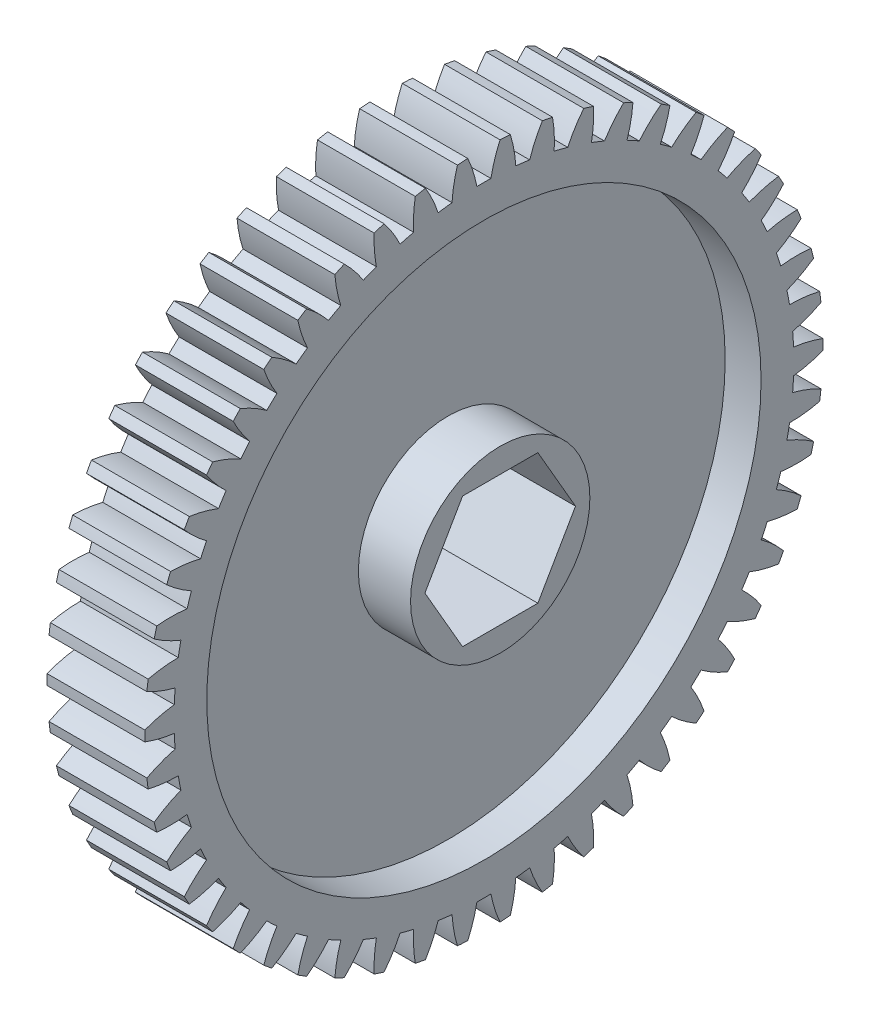
from build123d import *

# Parameters (mm, degrees)
SKETCH1_W           = 9.525
SKETCH1_H           = 33.02
CUT_EXTRUDE1_DEPTH  = 48.658854634
CUT_EXTRUDE2_DEPTH  = 48.658854634
CUT_EXTRUDE3_DEPTH  = 48.658854634
CUT_EXTRUDE4_DEPTH  = 48.658854634
CUT_EXTRUDE5_DEPTH  = 48.658854634
CUT_EXTRUDE6_DEPTH  = 48.658854634
CUT_EXTRUDE7_DEPTH  = 48.658854634
CUT_EXTRUDE8_DEPTH  = 48.658854634
CUT_EXTRUDE9_DEPTH  = 48.658854634
CUT_EXTRUDE10_DEPTH = 48.658854634
CUT_EXTRUDE11_DEPTH = 48.658854634
CUT_EXTRUDE12_DEPTH = 48.658854634
CUT_EXTRUDE13_DEPTH = 48.658854634
CUT_EXTRUDE14_DEPTH = 48.658854634
CUT_EXTRUDE15_DEPTH = 48.658854634
CUT_EXTRUDE16_DEPTH = 48.658854634
CUT_EXTRUDE17_DEPTH = 48.658854634
CUT_EXTRUDE18_DEPTH = 48.658854634
CUT_EXTRUDE19_DEPTH = 48.658854634
CUT_EXTRUDE20_DEPTH = 48.658854634
CUT_EXTRUDE21_DEPTH = 48.658854634
CUT_EXTRUDE22_DEPTH = 48.658854634
CUT_EXTRUDE23_DEPTH = 48.658854634
CUT_EXTRUDE24_DEPTH = 48.658854634
CUT_EXTRUDE25_DEPTH = 48.658854634
CUT_EXTRUDE26_DEPTH = 48.658854634
CUT_EXTRUDE27_DEPTH = 48.658854634
CUT_EXTRUDE28_DEPTH = 48.632979039
CUT_EXTRUDE29_DEPTH = 48.632979039
CUT_EXTRUDE30_DEPTH = 48.632979039
CUT_EXTRUDE31_DEPTH = 48.632979039
CUT_EXTRUDE32_DEPTH = 48.632979039
CUT_EXTRUDE33_DEPTH = 48.632979039
CUT_EXTRUDE34_DEPTH = 48.632979039
CUT_EXTRUDE35_DEPTH = 48.632979039
CUT_EXTRUDE36_DEPTH = 48.632979039
CUT_EXTRUDE37_DEPTH = 48.632979039
CUT_EXTRUDE38_DEPTH = 48.632979039
CUT_EXTRUDE39_DEPTH = 48.632979039
CUT_EXTRUDE40_DEPTH = 48.632979039
CUT_EXTRUDE41_DEPTH = 48.632979039
CUT_EXTRUDE42_DEPTH = 48.632979039
CUT_EXTRUDE43_DEPTH = 48.632979039
CUT_EXTRUDE44_DEPTH = 48.632979039
CUT_EXTRUDE45_DEPTH = 48.632979039
CUT_EXTRUDE46_DEPTH = 48.632979039
CUT_EXTRUDE47_DEPTH = 48.632979039
CUT_EXTRUDE48_DEPTH = 48.632979039
CUT_EXTRUDE49_DEPTH = 48.632979039
CUT_EXTRUDE50_DEPTH = 48.632979039
HOLE1_D             = 53.975
HOLE1_DEPTH         = 3.4925
SKETCH54_R          = 8.73125
BOSS_EXTRUDE1_DEPTH = 5.08
HOLE2_D             = 53.975
HOLE2_DEPTH         = 3.4925
BOSS_EXTRUDE2_START = 5.08
SKETCH57_R          = 8.73125
BOSS_EXTRUDE2_DEPTH = 5.08
CUT_EXTRUDE51_DEPTH = 49.368016986


with BuildPart() as part:
    # Sketch1 → Revolve1 (revolve)
    with BuildSketch(Plane(origin=(0, 0, 0), x_dir=(-1, 0, 0), z_dir=(0, 0, -1))):
        with Locations((-4.7625, 16.51)):
            Rectangle(SKETCH1_W, SKETCH1_H)
    revolve(axis=Axis((9.525, 0, 0), (-1, 0, 0)))

    # Sketch2 → Cut-Extrude1 (cut, through all)
    with BuildSketch(Plane.ZY):
        with BuildLine():
            ThreePointArc((-2.575937954, 32.919370341), (-4.138503372, 32.759627437), (-5.691704369, 32.525757507))
            ThreePointArc((-5.691704369, 32.525757507), (-4.996674373, 31.220882798), (-4.457999437, 29.844077068))
            ThreePointArc((-4.457999437, 29.844077068), (-3.781955389, 29.937259535), (-3.103976971, 30.015129885))
            ThreePointArc((-3.103976971, 30.015129885), (-2.924623161, 31.482643739), (-2.575937954, 32.919370341))
        make_face()
    extrude(amount=-CUT_EXTRUDE1_DEPTH, mode=Mode.SUBTRACT)

    # Sketch3 → Cut-Extrude2 (cut, through all)
    with BuildSketch(Plane.ZY):
        with BuildLine():
            ThreePointArc((1.570265218, 32.982641907), (0, 33.02), (-1.570265218, 32.982641907))
            ThreePointArc((-1.570265218, 32.982641907), (-1.044259907, 31.600946168), (-0.682392098, 30.167483091))
            ThreePointArc((-0.682392098, 30.167483091), (0, 30.1752), (0.682392098, 30.167483091))
            ThreePointArc((0.682392098, 30.167483091), (1.044259907, 31.600946168), (1.570265218, 32.982641907))
        make_face()
    extrude(amount=-CUT_EXTRUDE2_DEPTH, mode=Mode.SUBTRACT)

    # Sketch4 → Cut-Extrude3 (cut, through all)
    with BuildSketch(Plane.ZY):
        with BuildLine():
            ThreePointArc((5.691704369, 32.525757507), (4.138503372, 32.759627437), (2.575937954, 32.919370341))
            ThreePointArc((2.575937954, 32.919370341), (2.924623161, 31.482643739), (3.103976971, 30.015129885))
            ThreePointArc((3.103976971, 30.015129885), (3.781955389, 29.937259535), (4.457999437, 29.844077068))
            ThreePointArc((4.457999437, 29.844077068), (4.996674373, 31.220882798), (5.691704369, 32.525757507))
        make_face()
    extrude(amount=-CUT_EXTRUDE3_DEPTH, mode=Mode.SUBTRACT)

    # Sketch5 → Cut-Extrude4 (cut, through all)
    with BuildSketch(Plane.ZY):
        with BuildLine():
            ThreePointArc((9.723381942, 31.555922481), (8.211740074, 31.98261598), (6.681517046, 32.33694064))
            ThreePointArc((6.681517046, 32.33694064), (6.847383175, 30.867841212), (6.84139447, 29.38942015))
            ThreePointArc((6.84139447, 29.38942015), (7.504267083, 29.227190604), (8.163301462, 29.050012122))
            ThreePointArc((8.163301462, 29.050012122), (8.870288299, 30.348447455), (9.723381942, 31.555922481))
        make_face()
    extrude(amount=-CUT_EXTRUDE4_DEPTH, mode=Mode.SUBTRACT)

    # Sketch6 → Cut-Extrude5 (cut, through all)
    with BuildSketch(Plane.ZY):
        with BuildLine():
            ThreePointArc((13.601715974, 30.088431707), (12.15547273, 30.701219564), (10.681724622, 31.244538068))
            ThreePointArc((10.681724622, 31.244538068), (10.662155866, 29.76623439), (10.470919091, 28.300221703))
            ThreePointArc((10.470919091, 28.300221703), (11.108232002, 28.056191417), (11.739863346, 27.797811131))
            ThreePointArc((11.739863346, 27.797811131), (12.604012479, 28.997398967), (13.601715974, 30.088431707))
        make_face()
    extrude(amount=-CUT_EXTRUDE5_DEPTH, mode=Mode.SUBTRACT)

    # Sketch7 → Cut-Extrude6 (cut, through all)
    with BuildSketch(Plane.ZY):
        with BuildLine():
            ThreePointArc((17.26554282, 28.14642839), (15.907506319, 28.935646575), (14.513475021, 29.659390466))
            ThreePointArc((14.513475021, 29.659390466), (14.308779989, 28.195196269), (13.935311063, 26.764711854))
            ThreePointArc((13.935311063, 26.764711854), (14.537013467, 26.442729332), (15.131280572, 26.107222052))
            ThreePointArc((15.131280572, 26.107222052), (16.138963854, 27.189044175), (17.26554282, 28.14642839))
        make_face()
    extrude(amount=-CUT_EXTRUDE6_DEPTH, mode=Mode.SUBTRACT)

    # Sketch8 → Cut-Extrude7 (cut, through all)
    with BuildSketch(Plane.ZY):
        with BuildLine():
            ThreePointArc((20.657081741, 25.760539085), (19.408669031, 26.713741154), (18.116339248, 27.606496559))
            ThreePointArc((18.116339248, 27.606496559), (17.729746104, 26.179503061), (17.179934855, 24.80710651))
            ThreePointArc((17.179934855, 24.80710651), (17.736537545, 24.412249609), (18.284068464, 24.004906487))
            ThreePointArc((18.284068464, 24.004906487), (19.419394127, 24.951901915), (20.657081741, 25.760539085))
        make_face()
    extrude(amount=-CUT_EXTRUDE7_DEPTH, mode=Mode.SUBTRACT)

    # Sketch9 → Cut-Extrude8 (cut, through all)
    with BuildSketch(Plane.ZY):
        with BuildLine():
            ThreePointArc((23.722846143, 22.968390689), (22.603745438, 24.070544077), (21.433497983, 25.11823171))
            ThreePointArc((21.433497983, 25.11823171), (20.871103533, 23.75094345), (20.153620812, 22.458278278))
            ThreePointArc((20.153620812, 22.458278278), (20.656345831, 21.996774126), (21.148505675, 21.524019206))
            ThreePointArc((21.148505675, 21.524019206), (22.393568955, 22.321253256), (23.722846143, 22.968390689))
        make_face()
    extrude(amount=-CUT_EXTRUDE8_DEPTH, mode=Mode.SUBTRACT)

    # Sketch10 → Cut-Extrude9 (cut, through all)
    with BuildSketch(Plane.ZY):
        with BuildLine():
            ThreePointArc((26.414487091, 19.814017052), (25.442347276, 21.047740142), (24.412637651, 22.233837341))
            ThreePointArc((24.412637651, 22.233837341), (23.68331119, 20.947817273), (22.809472129, 19.755269581))
            ThreePointArc((22.809472129, 19.755269581), (23.250391203, 19.234396375), (23.679418317, 18.703685284))
            ThreePointArc((23.679418317, 18.703685284), (25.014583823, 19.338585099), (26.414487091, 19.814017052))
        make_face()
    extrude(amount=-CUT_EXTRUDE9_DEPTH, mode=Mode.SUBTRACT)

    # Sketch11 → Cut-Extrude10 (cut, through all)
    with BuildSketch(Plane.ZY):
        with BuildLine():
            ThreePointArc((28.689555797, 16.347164529), (27.8797081, 17.69300077), (27.00677544, 18.998802076))
            ThreePointArc((27.00677544, 18.998802076), (26.122018882, 17.814331504), (25.105604445, 16.740708482))
            ThreePointArc((25.105604445, 16.740708482), (25.477764018, 16.168680704), (25.836892387, 15.588383073))
            ThreePointArc((25.836892387, 15.588383073), (27.241103761, 16.050935902), (28.689555797, 16.347164529))
        make_face()
    extrude(amount=-CUT_EXTRUDE10_DEPTH, mode=Mode.SUBTRACT)

    # Sketch12 → Cut-Extrude11 (cut, through all)
    with BuildSketch(Plane.ZY):
        with BuildLine():
            ThreePointArc((30.512173071, 12.622507457), (29.877389272, 14.059232207), (29.175000247, 15.464144353))
            ThreePointArc((29.175000247, 15.464144353), (28.148766733, 14.399903086), (27.005806382, 13.46213641))
            ThreePointArc((27.005806382, 13.46213641), (27.303337274, 12.847975279), (27.58690323, 12.227242748))
            ThreePointArc((27.58690323, 12.227242748), (29.038015219, 12.510153858), (30.512173071, 12.622507457))
        make_face()
    extrude(amount=-CUT_EXTRUDE11_DEPTH, mode=Mode.SUBTRACT)

    # Sketch13 → Cut-Extrude12 (cut, through all)
    with BuildSketch(Plane.ZY):
        with BuildLine():
            ThreePointArc((31.853595148, 8.698785901), (31.403886168, 10.203741154), (30.883117872, 11.685607836))
            ThreePointArc((30.883117872, 11.685607836), (29.731591716, 10.758379593), (28.480110619, 9.971258405))
            ThreePointArc((28.480110619, 9.971258405), (28.698320591, 9.324649609), (28.901852129, 8.673271501))
            ThreePointArc((28.901852129, 8.673271501), (30.376979832, 8.772079215), (31.853595148, 8.698785901))
        make_face()
    extrude(amount=-CUT_EXTRUDE12_DEPTH, mode=Mode.SUBTRACT)

    # Sketch14 → Cut-Extrude13 (cut, through all)
    with BuildSketch(Plane.ZY):
        with BuildLine():
            ThreePointArc((32.692667001, 4.637879295), (32.435125019, 6.187331008), (32.10419028, 7.722782302))
            ThreePointArc((32.10419028, 7.722782302), (30.845531737, 6.947190028), (29.505266499, 6.323127698))
            ThreePointArc((29.505266499, 6.323127698), (29.640714248, 5.654268644), (29.761001556, 4.982517581))
            ThreePointArc((29.761001556, 4.982517581), (31.236881326, 4.895663642), (32.692667001, 4.637879295))
        make_face()
    extrude(amount=-CUT_EXTRUDE13_DEPTH, mode=Mode.SUBTRACT)

    # Sketch15 → Cut-Extrude14 (cut, through all)
    with BuildSketch(Plane.ZY):
        with BuildLine():
            ThreePointArc((33.016155966, 0.503830563), (32.954842573, 2.073342955), (32.818960428, 3.638163879))
            ThreePointArc((32.818960428, 3.638163879), (31.473019297, 3.026439126), (30.0651067, 2.57527749))
            ThreePointArc((30.0651067, 2.57527749), (30.115656136, 1.894716485), (30.150802209, 1.213186383))
            ThreePointArc((30.150802209, 1.213186383), (31.604158541, 0.942040529), (33.016155966, 0.503830563))
        make_face()
    extrude(amount=-CUT_EXTRUDE14_DEPTH, mode=Mode.SUBTRACT)

    # Sketch16 → Cut-Extrude15 (cut, through all)
    with BuildSketch(Plane.ZY):
        with BuildLine():
            ThreePointArc((32.818960428, -3.638163879), (32.954842573, -2.073342955), (33.016155966, -0.503830563))
            ThreePointArc((33.016155966, -0.503830563), (31.604158541, -0.942040529), (30.150802209, -1.213186383))
            ThreePointArc((30.150802209, -1.213186383), (30.115656136, -1.894716485), (30.0651067, -2.57527749))
            ThreePointArc((30.0651067, -2.57527749), (31.473019297, -3.026439126), (32.818960428, -3.638163879))
        make_face()
    extrude(amount=-CUT_EXTRUDE15_DEPTH, mode=Mode.SUBTRACT)

    # Sketch17 → Cut-Extrude16 (cut, through all)
    with BuildSketch(Plane.ZY):
        with BuildLine():
            ThreePointArc((32.10419028, -7.722782302), (32.435125019, -6.187331008), (32.692667001, -4.637879295))
            ThreePointArc((32.692667001, -4.637879295), (31.236881326, -4.895663642), (29.761001556, -4.982517581))
            ThreePointArc((29.761001556, -4.982517581), (29.640714248, -5.654268644), (29.505266499, -6.323127698))
            ThreePointArc((29.505266499, -6.323127698), (30.845531737, -6.947190028), (32.10419028, -7.722782302))
        make_face()
    extrude(amount=-CUT_EXTRUDE16_DEPTH, mode=Mode.SUBTRACT)

    # Sketch18 → Cut-Extrude17 (cut, through all)
    with BuildSketch(Plane.ZY):
        with BuildLine():
            ThreePointArc((30.883117872, -11.685607836), (31.403886168, -10.203741154), (31.853595148, -8.698785901))
            ThreePointArc((31.853595148, -8.698785901), (30.376979832, -8.772079215), (28.901852129, -8.673271501))
            ThreePointArc((28.901852129, -8.673271501), (28.698320591, -9.324649609), (28.480110619, -9.971258405))
            ThreePointArc((28.480110619, -9.971258405), (29.731591716, -10.758379593), (30.883117872, -11.685607836))
        make_face()
    extrude(amount=-CUT_EXTRUDE17_DEPTH, mode=Mode.SUBTRACT)

    # Sketch19 → Cut-Extrude18 (cut, through all)
    with BuildSketch(Plane.ZY):
        with BuildLine():
            ThreePointArc((29.175000247, -15.464144353), (29.877389272, -14.059232207), (30.512173071, -12.622507457))
            ThreePointArc((30.512173071, -12.622507457), (29.038015219, -12.510153858), (27.58690323, -12.227242748))
            ThreePointArc((27.58690323, -12.227242748), (27.303337274, -12.847975279), (27.005806382, -13.46213641))
            ThreePointArc((27.005806382, -13.46213641), (28.148766733, -14.399903086), (29.175000247, -15.464144353))
        make_face()
    extrude(amount=-CUT_EXTRUDE18_DEPTH, mode=Mode.SUBTRACT)

    # Sketch20 → Cut-Extrude19 (cut, through all)
    with BuildSketch(Plane.ZY):
        with BuildLine():
            ThreePointArc((27.00677544, -18.998802076), (27.8797081, -17.69300077), (28.689555797, -16.347164529))
            ThreePointArc((28.689555797, -16.347164529), (27.241103761, -16.050935902), (25.836892387, -15.588383073))
            ThreePointArc((25.836892387, -15.588383073), (25.477764018, -16.168680704), (25.105604445, -16.740708482))
            ThreePointArc((25.105604445, -16.740708482), (26.122018882, -17.814331504), (27.00677544, -18.998802076))
        make_face()
    extrude(amount=-CUT_EXTRUDE19_DEPTH, mode=Mode.SUBTRACT)

    # Sketch21 → Cut-Extrude20 (cut, through all)
    with BuildSketch(Plane.ZY):
        with BuildLine():
            ThreePointArc((24.412637651, -22.233837341), (25.442347276, -21.047740142), (26.414487091, -19.814017052))
            ThreePointArc((26.414487091, -19.814017052), (25.014583823, -19.338585099), (23.679418317, -18.703685284))
            ThreePointArc((23.679418317, -18.703685284), (23.250391203, -19.234396375), (22.809472129, -19.755269581))
            ThreePointArc((22.809472129, -19.755269581), (23.68331119, -20.947817273), (24.412637651, -22.233837341))
        make_face()
    extrude(amount=-CUT_EXTRUDE20_DEPTH, mode=Mode.SUBTRACT)

    # Sketch22 → Cut-Extrude21 (cut, through all)
    with BuildSketch(Plane.ZY):
        with BuildLine():
            ThreePointArc((21.433497983, -25.11823171), (22.603745438, -24.070544077), (23.722846143, -22.968390689))
            ThreePointArc((23.722846143, -22.968390689), (22.393568955, -22.321253256), (21.148505675, -21.524019206))
            ThreePointArc((21.148505675, -21.524019206), (20.656345831, -21.996774126), (20.153620812, -22.458278278))
            ThreePointArc((20.153620812, -22.458278278), (20.871103533, -23.75094345), (21.433497983, -25.11823171))
        make_face()
    extrude(amount=-CUT_EXTRUDE21_DEPTH, mode=Mode.SUBTRACT)

    # Sketch23 → Cut-Extrude22 (cut, through all)
    with BuildSketch(Plane.ZY):
        with BuildLine():
            ThreePointArc((18.116339248, -27.606496559), (19.408669031, -26.713741154), (20.657081741, -25.760539085))
            ThreePointArc((20.657081741, -25.760539085), (19.419394127, -24.951901915), (18.284068464, -24.004906487))
            ThreePointArc((18.284068464, -24.004906487), (17.736537545, -24.412249609), (17.179934855, -24.80710651))
            ThreePointArc((17.179934855, -24.80710651), (17.729746104, -26.179503061), (18.116339248, -27.606496559))
        make_face()
    extrude(amount=-CUT_EXTRUDE22_DEPTH, mode=Mode.SUBTRACT)

    # Sketch24 → Cut-Extrude23 (cut, through all)
    with BuildSketch(Plane.ZY):
        with BuildLine():
            ThreePointArc((14.513475021, -29.659390466), (15.907506319, -28.935646575), (17.26554282, -28.14642839))
            ThreePointArc((17.26554282, -28.14642839), (16.138963854, -27.189044175), (15.131280572, -26.107222052))
            ThreePointArc((15.131280572, -26.107222052), (14.537013467, -26.442729332), (13.935311063, -26.764711854))
            ThreePointArc((13.935311063, -26.764711854), (14.308779989, -28.195196269), (14.513475021, -29.659390466))
        make_face()
    extrude(amount=-CUT_EXTRUDE23_DEPTH, mode=Mode.SUBTRACT)

    # Sketch25 → Cut-Extrude24 (cut, through all)
    with BuildSketch(Plane.ZY):
        with BuildLine():
            ThreePointArc((10.681724622, -31.244538068), (12.15547273, -30.701219564), (13.601715974, -30.088431707))
            ThreePointArc((13.601715974, -30.088431707), (12.604012479, -28.997398967), (11.739863346, -27.797811131))
            ThreePointArc((11.739863346, -27.797811131), (11.108232002, -28.056191417), (10.470919091, -28.300221703))
            ThreePointArc((10.470919091, -28.300221703), (10.662155866, -29.76623439), (10.681724622, -31.244538068))
        make_face()
    extrude(amount=-CUT_EXTRUDE24_DEPTH, mode=Mode.SUBTRACT)

    # Sketch26 → Cut-Extrude25 (cut, through all)
    with BuildSketch(Plane.ZY):
        with BuildLine():
            ThreePointArc((6.681517046, -32.33694064), (8.211740074, -31.98261598), (9.723381942, -31.555922481))
            ThreePointArc((9.723381942, -31.555922481), (8.870288299, -30.348447455), (8.163301462, -29.050012122))
            ThreePointArc((8.163301462, -29.050012122), (7.504267083, -29.227190604), (6.84139447, -29.38942015))
            ThreePointArc((6.84139447, -29.38942015), (6.847383175, -30.867841212), (6.681517046, -32.33694064))
        make_face()
    extrude(amount=-CUT_EXTRUDE25_DEPTH, mode=Mode.SUBTRACT)

    # Sketch27 → Cut-Extrude26 (cut, through all)
    with BuildSketch(Plane.ZY):
        with BuildLine():
            ThreePointArc((2.575937954, -32.919370341), (4.138503372, -32.759627437), (5.691704369, -32.525757507))
            ThreePointArc((5.691704369, -32.525757507), (4.996674373, -31.220882798), (4.457999437, -29.844077068))
            ThreePointArc((4.457999437, -29.844077068), (3.781955389, -29.937259535), (3.103976971, -30.015129885))
            ThreePointArc((3.103976971, -30.015129885), (2.924623161, -31.482643739), (2.575937954, -32.919370341))
        make_face()
    extrude(amount=-CUT_EXTRUDE26_DEPTH, mode=Mode.SUBTRACT)

    # Sketch28 → Cut-Extrude27 (cut, through all)
    with BuildSketch(Plane.ZY):
        with BuildLine():
            ThreePointArc((-1.570265218, -32.982641907), (0, -33.02), (1.570265218, -32.982641907))
            ThreePointArc((1.570265218, -32.982641907), (1.044259907, -31.600946168), (0.682392098, -30.167483091))
            ThreePointArc((0.682392098, -30.167483091), (0, -30.1752), (-0.682392098, -30.167483091))
            ThreePointArc((-0.682392098, -30.167483091), (-1.044259907, -31.600946168), (-1.570265218, -32.982641907))
        make_face()
    extrude(amount=-CUT_EXTRUDE27_DEPTH, mode=Mode.SUBTRACT)

    # Sketch29 → Cut-Extrude28 (cut, through all)
    with BuildSketch(Plane.ZY):
        with BuildLine():
            ThreePointArc((-5.691704369, -32.525757507), (-4.138503372, -32.759627437), (-2.575937954, -32.919370341))
            ThreePointArc((-2.575937954, -32.919370341), (-2.924623161, -31.482643739), (-3.103976971, -30.015129885))
            ThreePointArc((-3.103976971, -30.015129885), (-3.781955389, -29.937259535), (-4.457999437, -29.844077068))
            ThreePointArc((-4.457999437, -29.844077068), (-4.996674373, -31.220882798), (-5.691704369, -32.525757507))
        make_face()
    extrude(amount=-CUT_EXTRUDE28_DEPTH, mode=Mode.SUBTRACT)

    # Sketch30 → Cut-Extrude29 (cut, through all)
    with BuildSketch(Plane.ZY):
        with BuildLine():
            ThreePointArc((-9.723381942, -31.555922481), (-8.211740074, -31.98261598), (-6.681517046, -32.33694064))
            ThreePointArc((-6.681517046, -32.33694064), (-6.847383175, -30.867841212), (-6.84139447, -29.38942015))
            ThreePointArc((-6.84139447, -29.38942015), (-7.504267083, -29.227190604), (-8.163301462, -29.050012122))
            ThreePointArc((-8.163301462, -29.050012122), (-8.870288299, -30.348447455), (-9.723381942, -31.555922481))
        make_face()
    extrude(amount=-CUT_EXTRUDE29_DEPTH, mode=Mode.SUBTRACT)

    # Sketch31 → Cut-Extrude30 (cut, through all)
    with BuildSketch(Plane.ZY):
        with BuildLine():
            ThreePointArc((-13.601715974, -30.088431707), (-12.15547273, -30.701219564), (-10.681724622, -31.244538068))
            ThreePointArc((-10.681724622, -31.244538068), (-10.662155866, -29.76623439), (-10.470919091, -28.300221703))
            ThreePointArc((-10.470919091, -28.300221703), (-11.108232002, -28.056191417), (-11.739863346, -27.797811131))
            ThreePointArc((-11.739863346, -27.797811131), (-12.604012479, -28.997398967), (-13.601715974, -30.088431707))
        make_face()
    extrude(amount=-CUT_EXTRUDE30_DEPTH, mode=Mode.SUBTRACT)

    # Sketch32 → Cut-Extrude31 (cut, through all)
    with BuildSketch(Plane.ZY):
        with BuildLine():
            ThreePointArc((-17.26554282, -28.14642839), (-15.907506319, -28.935646575), (-14.513475021, -29.659390466))
            ThreePointArc((-14.513475021, -29.659390466), (-14.308779989, -28.195196269), (-13.935311063, -26.764711854))
            ThreePointArc((-13.935311063, -26.764711854), (-14.537013467, -26.442729332), (-15.131280572, -26.107222052))
            ThreePointArc((-15.131280572, -26.107222052), (-16.138963854, -27.189044175), (-17.26554282, -28.14642839))
        make_face()
    extrude(amount=-CUT_EXTRUDE31_DEPTH, mode=Mode.SUBTRACT)

    # Sketch33 → Cut-Extrude32 (cut, through all)
    with BuildSketch(Plane.ZY):
        with BuildLine():
            ThreePointArc((-20.657081741, -25.760539085), (-19.408669031, -26.713741154), (-18.116339248, -27.606496559))
            ThreePointArc((-18.116339248, -27.606496559), (-17.729746104, -26.179503061), (-17.179934855, -24.80710651))
            ThreePointArc((-17.179934855, -24.80710651), (-17.736537545, -24.412249609), (-18.284068464, -24.004906487))
            ThreePointArc((-18.284068464, -24.004906487), (-19.419394127, -24.951901915), (-20.657081741, -25.760539085))
        make_face()
    extrude(amount=-CUT_EXTRUDE32_DEPTH, mode=Mode.SUBTRACT)

    # Sketch34 → Cut-Extrude33 (cut, through all)
    with BuildSketch(Plane.ZY):
        with BuildLine():
            ThreePointArc((-23.722846143, -22.968390689), (-22.603745438, -24.070544077), (-21.433497983, -25.11823171))
            ThreePointArc((-21.433497983, -25.11823171), (-20.871103533, -23.75094345), (-20.153620812, -22.458278278))
            ThreePointArc((-20.153620812, -22.458278278), (-20.656345831, -21.996774126), (-21.148505675, -21.524019206))
            ThreePointArc((-21.148505675, -21.524019206), (-22.393568955, -22.321253256), (-23.722846143, -22.968390689))
        make_face()
    extrude(amount=-CUT_EXTRUDE33_DEPTH, mode=Mode.SUBTRACT)

    # Sketch35 → Cut-Extrude34 (cut, through all)
    with BuildSketch(Plane.ZY):
        with BuildLine():
            ThreePointArc((-26.414487091, -19.814017052), (-25.442347276, -21.047740142), (-24.412637651, -22.233837341))
            ThreePointArc((-24.412637651, -22.233837341), (-23.68331119, -20.947817273), (-22.809472129, -19.755269581))
            ThreePointArc((-22.809472129, -19.755269581), (-23.250391203, -19.234396375), (-23.679418317, -18.703685284))
            ThreePointArc((-23.679418317, -18.703685284), (-25.014583823, -19.338585099), (-26.414487091, -19.814017052))
        make_face()
    extrude(amount=-CUT_EXTRUDE34_DEPTH, mode=Mode.SUBTRACT)

    # Sketch36 → Cut-Extrude35 (cut, through all)
    with BuildSketch(Plane.ZY):
        with BuildLine():
            ThreePointArc((-28.689555797, -16.347164529), (-27.8797081, -17.69300077), (-27.00677544, -18.998802076))
            ThreePointArc((-27.00677544, -18.998802076), (-26.122018882, -17.814331504), (-25.105604445, -16.740708482))
            ThreePointArc((-25.105604445, -16.740708482), (-25.477764018, -16.168680704), (-25.836892387, -15.588383073))
            ThreePointArc((-25.836892387, -15.588383073), (-27.241103761, -16.050935902), (-28.689555797, -16.347164529))
        make_face()
    extrude(amount=-CUT_EXTRUDE35_DEPTH, mode=Mode.SUBTRACT)

    # Sketch37 → Cut-Extrude36 (cut, through all)
    with BuildSketch(Plane.ZY):
        with BuildLine():
            ThreePointArc((-30.512173071, -12.622507457), (-29.877389272, -14.059232207), (-29.175000247, -15.464144353))
            ThreePointArc((-29.175000247, -15.464144353), (-28.148766733, -14.399903086), (-27.005806382, -13.46213641))
            ThreePointArc((-27.005806382, -13.46213641), (-27.303337274, -12.847975279), (-27.58690323, -12.227242748))
            ThreePointArc((-27.58690323, -12.227242748), (-29.038015219, -12.510153858), (-30.512173071, -12.622507457))
        make_face()
    extrude(amount=-CUT_EXTRUDE36_DEPTH, mode=Mode.SUBTRACT)

    # Sketch38 → Cut-Extrude37 (cut, through all)
    with BuildSketch(Plane.ZY):
        with BuildLine():
            ThreePointArc((-31.853595148, -8.698785901), (-31.403886168, -10.203741154), (-30.883117872, -11.685607836))
            ThreePointArc((-30.883117872, -11.685607836), (-29.731591716, -10.758379593), (-28.480110619, -9.971258405))
            ThreePointArc((-28.480110619, -9.971258405), (-28.698320591, -9.324649609), (-28.901852129, -8.673271501))
            ThreePointArc((-28.901852129, -8.673271501), (-30.376979832, -8.772079215), (-31.853595148, -8.698785901))
        make_face()
    extrude(amount=-CUT_EXTRUDE37_DEPTH, mode=Mode.SUBTRACT)

    # Sketch39 → Cut-Extrude38 (cut, through all)
    with BuildSketch(Plane.ZY):
        with BuildLine():
            ThreePointArc((-32.692667001, -4.637879295), (-32.435125019, -6.187331008), (-32.10419028, -7.722782302))
            ThreePointArc((-32.10419028, -7.722782302), (-30.845531737, -6.947190028), (-29.505266499, -6.323127698))
            ThreePointArc((-29.505266499, -6.323127698), (-29.640714248, -5.654268644), (-29.761001556, -4.982517581))
            ThreePointArc((-29.761001556, -4.982517581), (-31.236881326, -4.895663642), (-32.692667001, -4.637879295))
        make_face()
    extrude(amount=-CUT_EXTRUDE38_DEPTH, mode=Mode.SUBTRACT)

    # Sketch40 → Cut-Extrude39 (cut, through all)
    with BuildSketch(Plane.ZY):
        with BuildLine():
            ThreePointArc((-33.016155966, -0.503830563), (-32.954842573, -2.073342955), (-32.818960428, -3.638163879))
            ThreePointArc((-32.818960428, -3.638163879), (-31.473019297, -3.026439126), (-30.0651067, -2.57527749))
            ThreePointArc((-30.0651067, -2.57527749), (-30.115656136, -1.894716485), (-30.150802209, -1.213186383))
            ThreePointArc((-30.150802209, -1.213186383), (-31.604158541, -0.942040529), (-33.016155966, -0.503830563))
        make_face()
    extrude(amount=-CUT_EXTRUDE39_DEPTH, mode=Mode.SUBTRACT)

    # Sketch41 → Cut-Extrude40 (cut, through all)
    with BuildSketch(Plane.ZY):
        with BuildLine():
            ThreePointArc((-32.818960428, 3.638163879), (-32.954842573, 2.073342955), (-33.016155966, 0.503830563))
            ThreePointArc((-33.016155966, 0.503830563), (-31.604158541, 0.942040529), (-30.150802209, 1.213186383))
            ThreePointArc((-30.150802209, 1.213186383), (-30.115656136, 1.894716485), (-30.0651067, 2.57527749))
            ThreePointArc((-30.0651067, 2.57527749), (-31.473019297, 3.026439126), (-32.818960428, 3.638163879))
        make_face()
    extrude(amount=-CUT_EXTRUDE40_DEPTH, mode=Mode.SUBTRACT)

    # Sketch42 → Cut-Extrude41 (cut, through all)
    with BuildSketch(Plane.ZY):
        with BuildLine():
            ThreePointArc((-32.10419028, 7.722782302), (-32.435125019, 6.187331008), (-32.692667001, 4.637879295))
            ThreePointArc((-32.692667001, 4.637879295), (-31.236881326, 4.895663642), (-29.761001556, 4.982517581))
            ThreePointArc((-29.761001556, 4.982517581), (-29.640714248, 5.654268644), (-29.505266499, 6.323127698))
            ThreePointArc((-29.505266499, 6.323127698), (-30.845531737, 6.947190028), (-32.10419028, 7.722782302))
        make_face()
    extrude(amount=-CUT_EXTRUDE41_DEPTH, mode=Mode.SUBTRACT)

    # Sketch43 → Cut-Extrude42 (cut, through all)
    with BuildSketch(Plane.ZY):
        with BuildLine():
            ThreePointArc((-30.883117872, 11.685607836), (-31.403886168, 10.203741154), (-31.853595148, 8.698785901))
            ThreePointArc((-31.853595148, 8.698785901), (-30.376979832, 8.772079215), (-28.901852129, 8.673271501))
            ThreePointArc((-28.901852129, 8.673271501), (-28.698320591, 9.324649609), (-28.480110619, 9.971258405))
            ThreePointArc((-28.480110619, 9.971258405), (-29.731591716, 10.758379593), (-30.883117872, 11.685607836))
        make_face()
    extrude(amount=-CUT_EXTRUDE42_DEPTH, mode=Mode.SUBTRACT)

    # Sketch44 → Cut-Extrude43 (cut, through all)
    with BuildSketch(Plane.ZY):
        with BuildLine():
            ThreePointArc((-29.175000247, 15.464144353), (-29.877389272, 14.059232207), (-30.512173071, 12.622507457))
            ThreePointArc((-30.512173071, 12.622507457), (-29.038015219, 12.510153858), (-27.58690323, 12.227242748))
            ThreePointArc((-27.58690323, 12.227242748), (-27.303337274, 12.847975279), (-27.005806382, 13.46213641))
            ThreePointArc((-27.005806382, 13.46213641), (-28.148766733, 14.399903086), (-29.175000247, 15.464144353))
        make_face()
    extrude(amount=-CUT_EXTRUDE43_DEPTH, mode=Mode.SUBTRACT)

    # Sketch45 → Cut-Extrude44 (cut, through all)
    with BuildSketch(Plane.ZY):
        with BuildLine():
            ThreePointArc((-27.00677544, 18.998802076), (-27.8797081, 17.69300077), (-28.689555797, 16.347164529))
            ThreePointArc((-28.689555797, 16.347164529), (-27.241103761, 16.050935902), (-25.836892387, 15.588383073))
            ThreePointArc((-25.836892387, 15.588383073), (-25.477764018, 16.168680704), (-25.105604445, 16.740708482))
            ThreePointArc((-25.105604445, 16.740708482), (-26.122018882, 17.814331504), (-27.00677544, 18.998802076))
        make_face()
    extrude(amount=-CUT_EXTRUDE44_DEPTH, mode=Mode.SUBTRACT)

    # Sketch46 → Cut-Extrude45 (cut, through all)
    with BuildSketch(Plane.ZY):
        with BuildLine():
            ThreePointArc((-24.412637651, 22.233837341), (-25.442347276, 21.047740142), (-26.414487091, 19.814017052))
            ThreePointArc((-26.414487091, 19.814017052), (-25.014583823, 19.338585099), (-23.679418317, 18.703685284))
            ThreePointArc((-23.679418317, 18.703685284), (-23.250391203, 19.234396375), (-22.809472129, 19.755269581))
            ThreePointArc((-22.809472129, 19.755269581), (-23.68331119, 20.947817273), (-24.412637651, 22.233837341))
        make_face()
    extrude(amount=-CUT_EXTRUDE45_DEPTH, mode=Mode.SUBTRACT)

    # Sketch47 → Cut-Extrude46 (cut, through all)
    with BuildSketch(Plane.ZY):
        with BuildLine():
            ThreePointArc((-21.433497983, 25.11823171), (-22.603745438, 24.070544077), (-23.722846143, 22.968390689))
            ThreePointArc((-23.722846143, 22.968390689), (-22.393568955, 22.321253256), (-21.148505675, 21.524019206))
            ThreePointArc((-21.148505675, 21.524019206), (-20.656345831, 21.996774126), (-20.153620812, 22.458278278))
            ThreePointArc((-20.153620812, 22.458278278), (-20.871103533, 23.75094345), (-21.433497983, 25.11823171))
        make_face()
    extrude(amount=-CUT_EXTRUDE46_DEPTH, mode=Mode.SUBTRACT)

    # Sketch48 → Cut-Extrude47 (cut, through all)
    with BuildSketch(Plane.ZY):
        with BuildLine():
            ThreePointArc((-18.116339248, 27.606496559), (-19.408669031, 26.713741154), (-20.657081741, 25.760539085))
            ThreePointArc((-20.657081741, 25.760539085), (-19.419394127, 24.951901915), (-18.284068464, 24.004906487))
            ThreePointArc((-18.284068464, 24.004906487), (-17.736537545, 24.412249609), (-17.179934855, 24.80710651))
            ThreePointArc((-17.179934855, 24.80710651), (-17.729746104, 26.179503061), (-18.116339248, 27.606496559))
        make_face()
    extrude(amount=-CUT_EXTRUDE47_DEPTH, mode=Mode.SUBTRACT)

    # Sketch49 → Cut-Extrude48 (cut, through all)
    with BuildSketch(Plane.ZY):
        with BuildLine():
            ThreePointArc((-14.513475021, 29.659390466), (-15.907506319, 28.935646575), (-17.26554282, 28.14642839))
            ThreePointArc((-17.26554282, 28.14642839), (-16.138963854, 27.189044175), (-15.131280572, 26.107222052))
            ThreePointArc((-15.131280572, 26.107222052), (-14.537013467, 26.442729332), (-13.935311063, 26.764711854))
            ThreePointArc((-13.935311063, 26.764711854), (-14.308779989, 28.195196269), (-14.513475021, 29.659390466))
        make_face()
    extrude(amount=-CUT_EXTRUDE48_DEPTH, mode=Mode.SUBTRACT)

    # Sketch50 → Cut-Extrude49 (cut, through all)
    with BuildSketch(Plane.ZY):
        with BuildLine():
            ThreePointArc((-10.681724622, 31.244538068), (-12.15547273, 30.701219564), (-13.601715974, 30.088431707))
            ThreePointArc((-13.601715974, 30.088431707), (-12.604012479, 28.997398967), (-11.739863346, 27.797811131))
            ThreePointArc((-11.739863346, 27.797811131), (-11.108232002, 28.056191417), (-10.470919091, 28.300221703))
            ThreePointArc((-10.470919091, 28.300221703), (-10.662155866, 29.76623439), (-10.681724622, 31.244538068))
        make_face()
    extrude(amount=-CUT_EXTRUDE49_DEPTH, mode=Mode.SUBTRACT)

    # Sketch51 → Cut-Extrude50 (cut, through all)
    with BuildSketch(Plane.ZY):
        with BuildLine():
            ThreePointArc((-6.681517046, 32.33694064), (-8.211740074, 31.98261598), (-9.723381942, 31.555922481))
            ThreePointArc((-9.723381942, 31.555922481), (-8.870288299, 30.348447455), (-8.163301462, 29.050012122))
            ThreePointArc((-8.163301462, 29.050012122), (-7.504267083, 29.227190604), (-6.84139447, 29.38942015))
            ThreePointArc((-6.84139447, 29.38942015), (-6.847383175, 30.867841212), (-6.681517046, 32.33694064))
        make_face()
    extrude(amount=-CUT_EXTRUDE50_DEPTH, mode=Mode.SUBTRACT)

    # Hole1
    with Locations(Plane(origin=(9.525, 0, 0), x_dir=(0, 0, -1), z_dir=(1, 0, 0))):
        with Locations((0, 0)):
            Hole(HOLE1_D / 2, depth=HOLE1_DEPTH)

    # Sketch54 → Boss-Extrude1 (add)
    with BuildSketch(Plane(origin=(6.0325, 0, 0), x_dir=(0, 0, -1), z_dir=(1, 0, 0))):
        Circle(SKETCH54_R)
    extrude(amount=BOSS_EXTRUDE1_DEPTH)

    # Hole2
    with Locations(Plane.ZY):
        with Locations((0, 0)):
            Hole(HOLE2_D / 2, depth=HOLE2_DEPTH)

    # Sketch57 → Boss-Extrude2 (add)
    with BuildSketch(Plane.ZY.offset(-3.4925).offset(BOSS_EXTRUDE2_START)):
        Circle(SKETCH57_R)
    extrude(amount=-BOSS_EXTRUDE2_DEPTH)

    # Sketch58 → Cut-Extrude51 (cut, through all)
    with BuildSketch(Plane.ZY.offset(1.5875)):
        Polygon((-3.666174209, -6.35), (3.666174209, -6.35), (7.332348419, 0), (3.666174209, 6.35), (-3.666174209, 6.35), (-7.332348419, 0), align=None)
    extrude(amount=-CUT_EXTRUDE51_DEPTH, mode=Mode.SUBTRACT)


solid = part.part
